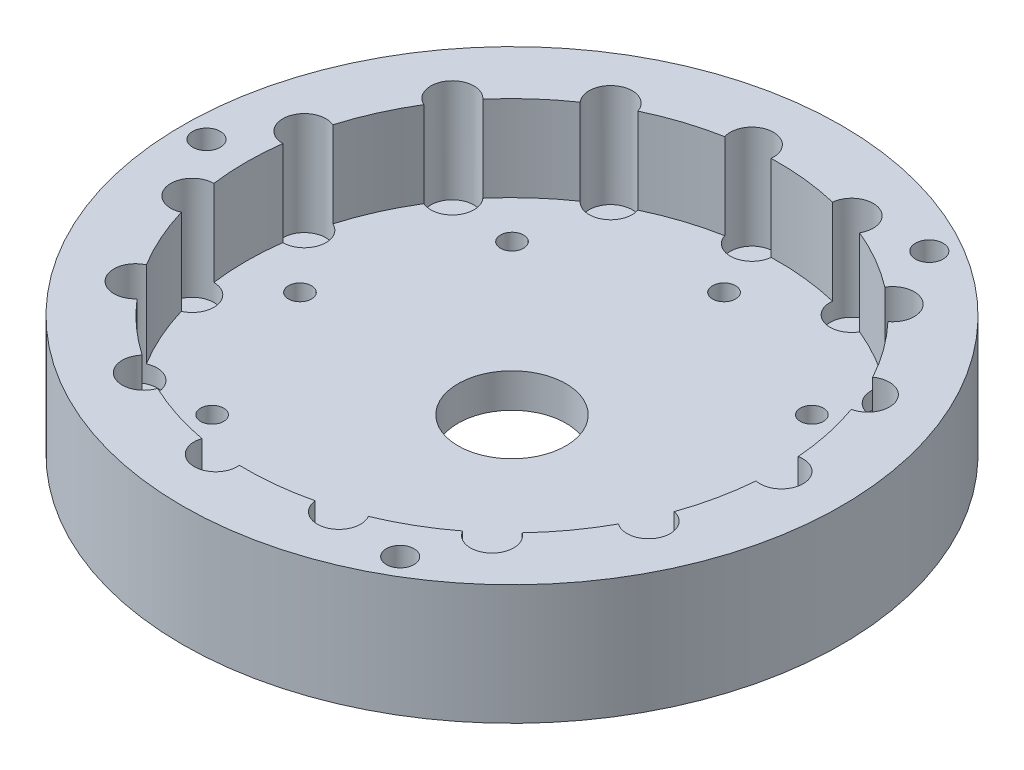
from build123d import *

# Parameters (mm, degrees)
SKETCH1_R           = 45.85
SKETCH1_R_2         = 1.5635
SKETCH1_R_3         = 7.5
BOSS_EXTRUDE1_DEPTH = 4.7625
SKETCH1_6_R         = 3
SKETCH1_6_R_2       = 1.607
CUT_EXTRUDE1_DEPTH  = 2.4105
BOSS_EXTRUDE2_START = 11.9355
SKETCH1_7_R         = 45.85
SKETCH1_7_R_2       = 1.5635
BOSS_EXTRUDE2_DEPTH = 11.9355
SKETCH2_R           = 1.925
CUT_EXTRUDE2_DEPTH  = 4


with BuildPart() as part:
    # Sketch1 → Boss-Extrude1 (new body)
    with BuildSketch(Plane(origin=(0, 0, 0), x_dir=(1, 0, 0), z_dir=(0, 1, 0))):
        Circle(SKETCH1_R)
        with Locations((-42.5, 0)):
            Circle(SKETCH1_R_2, mode=Mode.SUBTRACT)
        with Locations((21.25, -36.806079661)):
            Circle(SKETCH1_R_2, mode=Mode.SUBTRACT)
        with Locations((21.25, 36.806079661)):
            Circle(SKETCH1_R_2, mode=Mode.SUBTRACT)
        Circle(SKETCH1_R_3, mode=Mode.SUBTRACT)
    extrude(amount=-BOSS_EXTRUDE1_DEPTH)

    # Sketch1<6> → Cut-Extrude1 (cut)
    with BuildSketch(Plane(origin=(0, 0, 0), x_dir=(1, 0, 0), z_dir=(0, 1, 0))):
        with Locations((37.5, 0)):
            Circle(SKETCH1_6_R)
        with Locations((34.257954662, 15.252624115)):
            Circle(SKETCH1_6_R)
        with Locations((34.257954662, -15.252624115)):
            Circle(SKETCH1_6_R)
        with Locations((25.092397738, 27.867930955)):
            Circle(SKETCH1_6_R)
        with Locations((25.092397738, -27.867930955)):
            Circle(SKETCH1_6_R)
        with Locations((11.588137289, 35.664619361)):
            Circle(SKETCH1_6_R)
        with Locations((11.588137289, -35.664619361)):
            Circle(SKETCH1_6_R)
        with Locations((-3.919817373, 37.294571076)):
            Circle(SKETCH1_6_R)
        with Locations((-3.919817373, -37.294571076)):
            Circle(SKETCH1_6_R)
        with Locations((-18.75, 32.475952642)):
            Circle(SKETCH1_6_R)
        with Locations((-18.75, -32.475952642)):
            Circle(SKETCH1_6_R)
        with Locations((-30.338137289, 22.041946961)):
            Circle(SKETCH1_6_R)
        with Locations((-30.338137289, -22.041946961)):
            Circle(SKETCH1_6_R)
        with Locations((-36.680535028, 7.796688406)):
            Circle(SKETCH1_6_R)
        with Locations((-36.680535028, -7.796688406)):
            Circle(SKETCH1_6_R)
        with Locations((29.5, 0)):
            Circle(SKETCH1_6_R_2)
        with Locations((20.859650045, -20.859650045)):
            Circle(SKETCH1_6_R_2)
        with Locations((0, -29.5)):
            Circle(SKETCH1_6_R_2)
        with Locations((-20.859650045, -20.859650045)):
            Circle(SKETCH1_6_R_2)
        with Locations((-29.5, 0)):
            Circle(SKETCH1_6_R_2)
        with Locations((-20.859650045, 20.859650045)):
            Circle(SKETCH1_6_R_2)
        with Locations((0, 29.5)):
            Circle(SKETCH1_6_R_2)
        with Locations((20.859650045, 20.859650045)):
            Circle(SKETCH1_6_R_2)
    extrude(amount=-CUT_EXTRUDE1_DEPTH, mode=Mode.SUBTRACT)

    # Sketch1<7> → Boss-Extrude2 (add)
    with BuildSketch(Plane(origin=(0, 0, 0), x_dir=(1, 0, 0), z_dir=(0, 1, 0)).offset(BOSS_EXTRUDE2_START)):
        Circle(SKETCH1_7_R)
        with Locations((-42.5, 0)):
            Circle(SKETCH1_7_R_2, mode=Mode.SUBTRACT)
        with Locations((21.25, -36.806079661)):
            Circle(SKETCH1_7_R_2, mode=Mode.SUBTRACT)
        with BuildLine():
            ThreePointArc((36.883333333, 2.935936345), (39.39076704, 2.32916294), (40.5, 0))
            ThreePointArc((40.5, 0), (39.39076704, -2.32916294), (36.883333333, -2.935936345))
            ThreePointArc((36.883333333, -2.935936345), (36.191461227, -7.69273256), (34.888754523, -12.319691873))
            ThreePointArc((34.888754523, -12.319691873), (36.59166411, -13.367471546), (37.257954662, -15.252624115))
            ThreePointArc((37.257954662, -15.252624115), (35.6231437, -17.924001829), (32.500448736, -17.683914497))
            ThreePointArc((32.500448736, -17.683914497), (29.933628792, -21.748054335), (26.861593101, -25.445133446))
            ThreePointArc((26.861593101, -25.445133446), (27.767055295, -26.50917897), (28.092397738, -27.867930955))
            ThreePointArc((28.092397738, -27.867930955), (25.872343464, -30.764771418), (22.497941295, -29.37418318))
            ThreePointArc((22.497941295, -29.37418318), (18.5, -32.04293994), (14.189818202, -34.170880284))
            ThreePointArc((14.189818202, -34.170880284), (14.486847583, -34.891651942), (14.588137289, -35.664619361))
            ThreePointArc((14.588137289, -35.664619361), (11.748752331, -38.660316744), (8.605335417, -35.985388734))
            ThreePointArc((8.605335417, -35.985388734), (3.867553141, -36.797310129), (-0.935505175, -36.988171489))
            ThreePointArc((-0.935505175, -36.988171489), (-0.92374189, -37.141170608), (-0.919817373, -37.294571076))
            ThreePointArc((-0.919817373, -37.294571076), (-4.385552663, -40.258199029), (-6.775211132, -36.37439366))
            ThreePointArc((-6.775211132, -36.37439366), (-11.433628792, -35.189091103), (-15.899071208, -33.409871815))
            ThreePointArc((-15.899071208, -33.409871815), (-20.25, -35.074028853), (-20.984262125, -30.47393547))
            ThreePointArc((-20.984262125, -30.47393547), (-24.757832435, -27.496358543), (-28.113543391, -24.054701786))
            ThreePointArc((-28.113543391, -24.054701786), (-32.765188272, -23.805302718), (-31.564943561, -19.304256991))
            ThreePointArc((-31.564943561, -19.304256991), (-33.801181933, -15.049255794), (-35.466928517, -10.540255288))
            ThreePointArc((-35.466928517, -10.540255288), (-39.61497783, -8.420423478), (-36.687759497, -4.796697105))
            ThreePointArc((-36.687759497, -4.796697105), (-37, 0), (-36.687759497, 4.796697105))
            ThreePointArc((-36.687759497, 4.796697105), (-39.61497783, 8.420423478), (-35.466928517, 10.540255288))
            ThreePointArc((-35.466928517, 10.540255288), (-33.801181933, 15.049255794), (-31.564943561, 19.304256991))
            ThreePointArc((-31.564943561, 19.304256991), (-32.765188272, 23.805302718), (-28.113543391, 24.054701786))
            ThreePointArc((-28.113543391, 24.054701786), (-24.757832435, 27.496358543), (-20.984262125, 30.47393547))
            ThreePointArc((-20.984262125, 30.47393547), (-20.25, 35.074028853), (-15.899071208, 33.409871815))
            ThreePointArc((-15.899071208, 33.409871815), (-11.433628792, 35.189091103), (-6.775211132, 36.37439366))
            ThreePointArc((-6.775211132, 36.37439366), (-4.385552663, 40.258199029), (-0.919817373, 37.294571076))
            ThreePointArc((-0.919817373, 37.294571076), (-0.92374189, 37.141170608), (-0.935505175, 36.988171489))
            ThreePointArc((-0.935505175, 36.988171489), (3.867553141, 36.797310129), (8.605335417, 35.985388734))
            ThreePointArc((8.605335417, 35.985388734), (11.748752331, 38.660316744), (14.588137289, 35.664619361))
            ThreePointArc((14.588137289, 35.664619361), (14.486847583, 34.891651942), (14.189818202, 34.170880284))
            ThreePointArc((14.189818202, 34.170880284), (18.5, 32.04293994), (22.497941295, 29.37418318))
            ThreePointArc((22.497941295, 29.37418318), (25.872343464, 30.764771418), (28.092397738, 27.867930955))
            ThreePointArc((28.092397738, 27.867930955), (27.767055295, 26.50917897), (26.861593101, 25.445133446))
            ThreePointArc((26.861593101, 25.445133446), (29.933628792, 21.748054335), (32.500448736, 17.683914497))
            ThreePointArc((32.500448736, 17.683914497), (35.6231437, 17.924001829), (37.257954662, 15.252624115))
            ThreePointArc((37.257954662, 15.252624115), (36.59166411, 13.367471546), (34.888754523, 12.319691873))
            ThreePointArc((34.888754523, 12.319691873), (36.191461227, 7.69273256), (36.883333333, 2.935936345))
        make_face(mode=Mode.SUBTRACT)
        with Locations((21.25, 36.806079661)):
            Circle(SKETCH1_7_R_2, mode=Mode.SUBTRACT)
    extrude(amount=-BOSS_EXTRUDE2_DEPTH)

    # Sketch2 → Cut-Extrude2 (cut)
    with BuildSketch(Plane(origin=(0, 11.9355, 0), x_dir=(1, 0, 0), z_dir=(0, 1, 0))):
        with Locations((-42.5, 0)):
            Circle(SKETCH2_R)
        with Locations((21.25, 36.806079661)):
            Circle(SKETCH2_R)
        with Locations((21.25, -36.806079661)):
            Circle(SKETCH2_R)
    extrude(amount=-CUT_EXTRUDE2_DEPTH, mode=Mode.SUBTRACT)


solid = part.part
